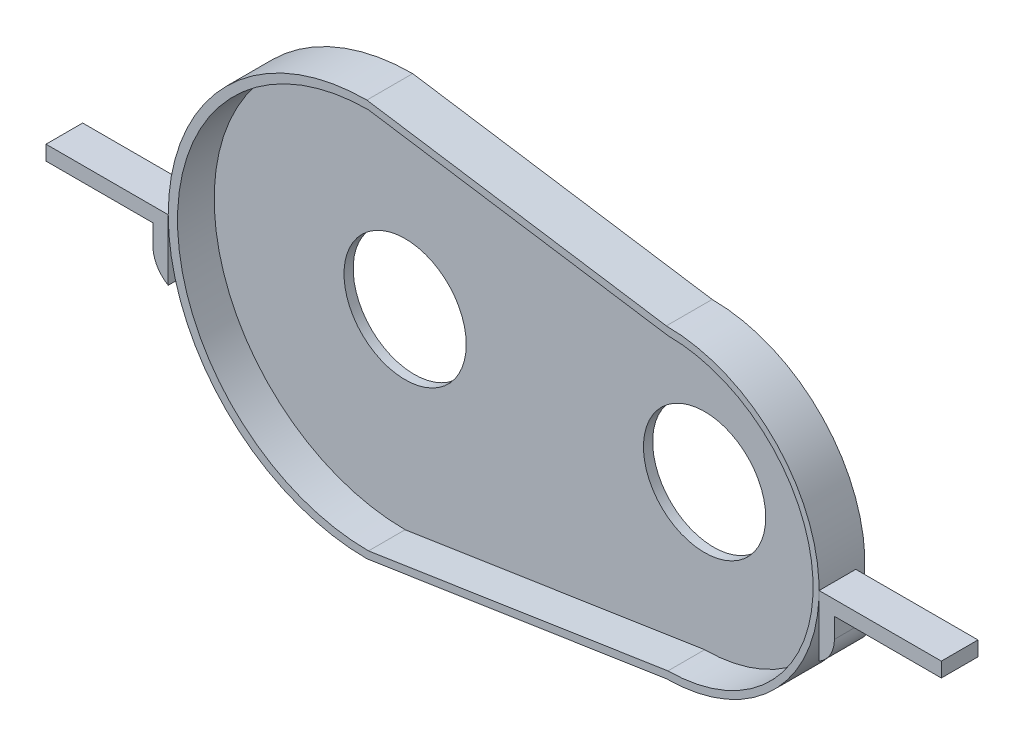
from build123d import *

# Parameters (mm, degrees)
BOSS_EXTRUDE1_DEPTH   = 15
CUT_EXTRUDE1_DEPTH    = 12
SKETCH3_R             = 20
CUT_EXTRUDE2_DEPTH    = 12
BOSS_EXTRUDE2_DEPTH   = 12
BOSS_EXTRUDE2_2_DEPTH = 12
FILLET1_R             = 10
FILLET2_R             = 10


with BuildPart() as part:
    # Sketch1 → Boss-Extrude1 (new body)
    with BuildSketch(Plane.XY):
        with BuildLine():
            Line((-56.393356643, 65), (41.606643357, 50))
            ThreePointArc((41.606643357, 50), (91.606643357, 0), (41.606643357, -50))
            Line((41.606643357, -50), (-56.393356643, -65))
            ThreePointArc((-56.393356643, -65), (-121.393356643, 0), (-56.393356643, 65))
        make_face()
    extrude(amount=-BOSS_EXTRUDE1_DEPTH)

    # Sketch2 → Cut-Extrude1 (cut)
    with BuildSketch(Plane.XY):
        with BuildLine():
            Line((-55.851288068, 62.5), (42.148711932, 47.5))
            ThreePointArc((42.148711932, 47.5), (89.648711932, 0), (42.148711932, -47.5))
            Line((42.148711932, -47.5), (-55.851288068, -62.5))
            ThreePointArc((-55.851288068, -62.5), (-118.351288068, 0), (-55.851288068, 62.5))
        make_face()
    extrude(amount=-CUT_EXTRUDE1_DEPTH, mode=Mode.SUBTRACT)

    # Sketch3 → Cut-Extrude2 (cut)
    with BuildSketch(Plane.XY.offset(-12)):
        with Locations((-55.870216449, 0)):
            Circle(SKETCH3_R)
        with Locations((42.129783551, 0)):
            Circle(SKETCH3_R)
    extrude(amount=-CUT_EXTRUDE2_DEPTH, mode=Mode.SUBTRACT)


with BuildPart() as body_2:
    # Sketch4 → Boss-Extrude2 (new body)
    with BuildSketch(Plane.XY.offset(-12)):
        Polygon((-161.393356643, 0), (-121.393356643, 0), (-121.393356643, -20), (-126.393356643, -20), (-126.393356643, -4.801542048), (-161.393356643, -4.801542048), align=None)
    extrude(amount=BOSS_EXTRUDE2_DEPTH)

    # Fillet1
    # the kernel refuses this fillet: 10 mm, written as the material it takes off along each edge
    with BuildSketch(Plane(origin=(-126.393356643, -20, -33.650635095), x_dir=(1, 0, 0), z_dir=(0, 0, 1))) as fillet1_piece_1:
        with BuildLine():
            CenterArc((10, 8.660254038), FILLET1_R, 180, 60)
            Line((0, 8.660254038), (-0.2, 8.660254038))
            Line((-0.2, 8.660254038), (-0.2, 0))
            Line((-0.2, 0), (0, -0.2))
            ThreePointArc((0, -0.2), (2.5, -0.2), (4.9, -0.173205081))
            Line((4.9, -0.173205081), (5, 0))
        make_face()
    extrude(amount=55.301270189, mode=Mode.SUBTRACT)


with BuildPart() as body_3:
    # Sketch4 → Boss-Extrude2 2 (new body)
    with BuildSketch(Plane.XY.offset(-12)):
        Polygon((91.606643357, 0), (131.606643357, 0), (131.606643357, -4.801542048), (96.606643357, -4.801542048), (96.606643357, -20), (91.606643357, -20), align=None)
    extrude(amount=BOSS_EXTRUDE2_2_DEPTH)

    # Fillet2
    # the kernel refuses this fillet: 10 mm, written as the material it takes off along each edge
    with BuildSketch(Plane(origin=(96.606643357, -20, -33.650635095), x_dir=(0, 1, 0), z_dir=(0, 0, 1))) as fillet2_piece_1:
        with BuildLine():
            CenterArc((8.660254038, 10), FILLET2_R, 210, 60)
            Line((0, 5), (-0.173205081, 4.9))
            ThreePointArc((-0.173205081, 4.9), (-0.2, 2.5), (-0.2, 0))
            Line((-0.2, 0), (0, -0.2))
            Line((0, -0.2), (8.660254038, -0.2))
            Line((8.660254038, -0.2), (8.660254038, 0))
        make_face()
    extrude(amount=55.301270189, mode=Mode.SUBTRACT)


solid = Compound([part.part, body_2.part, body_3.part])
